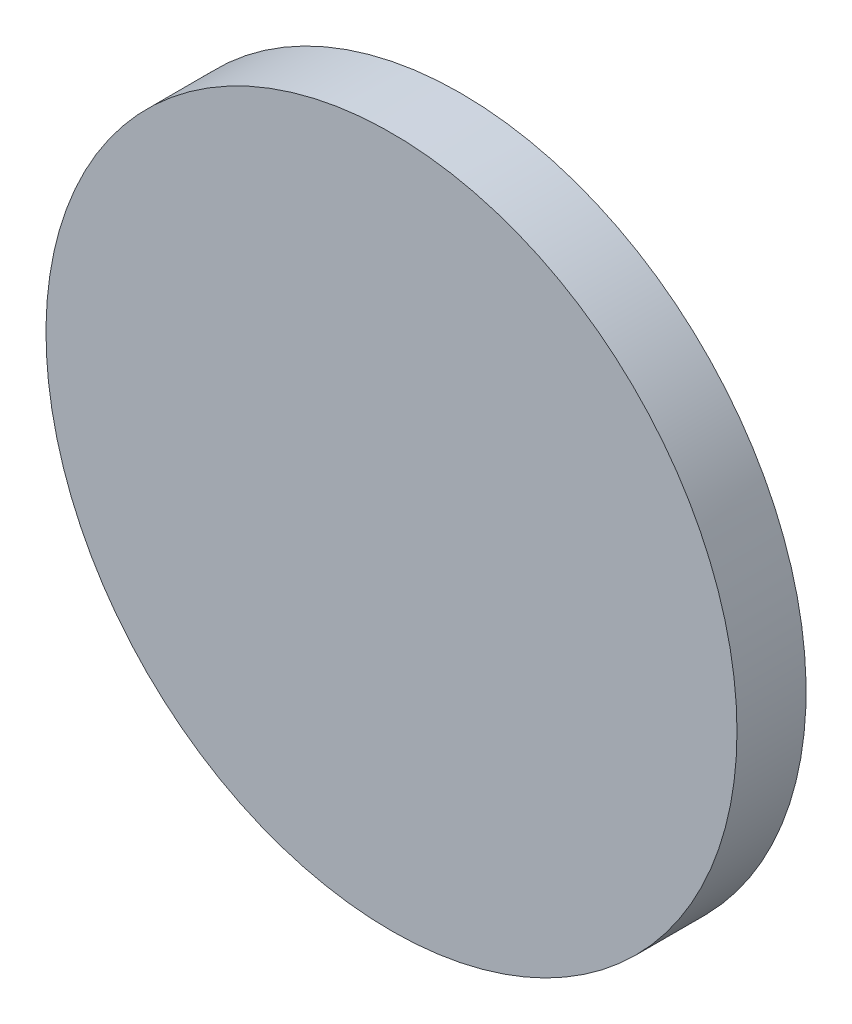
from build123d import *

# Parameters (mm, degrees)
SKETCH_2_R          = 20
EXTRUDE_1_DEPTH     = 4
CUT_EXTRUDE_1_DEPTH = 3


with BuildPart() as part:
    # 草图2 → 凸台-拉伸1 (new body)
    with BuildSketch(Plane.XY):
        with Locations((5.210280057, 9.537965238)):
            Circle(SKETCH_2_R)
    extrude(amount=EXTRUDE_1_DEPTH)

    # 草图3 → 切除-拉伸1 (cut)
    with BuildSketch(Plane.XY):
        with BuildLine():
            ThreePointArc((-2.289296886, -9.482598758), (5.210280057, -10.907706897), (12.709857001, -9.482598758))
            add(Edge.make_bspline(
                [(12.709857001, -9.482598758), (12.725547292, -9.101422423), (12.79577054, -8.745754176), (13.044226195, -8.070538748), (13.222761052, -7.750352447), (13.937748748, -6.82825193), (14.658723975, -6.2641295), (15.644981691, -5.768655121)],
                knots=[0, 0, 0, 0, 0.25, 0.25, 0.5, 0.5, 1, 1, 1, 1], degree=3))
            ThreePointArc((15.644981691, -5.768655121), (5.210280058, 28.062965238), (-5.224421578, -5.76865512))
            add(Edge.make_bspline(
                [(-5.224421578, -5.76865512), (-4.238163861, -6.2641295), (-3.517188634, -6.82825193), (-2.802200937, -7.750352447), (-2.62366608, -8.070538747), (-2.375210425, -8.745754176), (-2.304987177, -9.101422423), (-2.289296886, -9.482598758)],
                knots=[0, 0, 0, 0, 0.5, 0.5, 0.75, 0.75, 1, 1, 1, 1], degree=3))
        make_face()
    extrude(amount=CUT_EXTRUDE_1_DEPTH, mode=Mode.SUBTRACT)


solid = part.part
